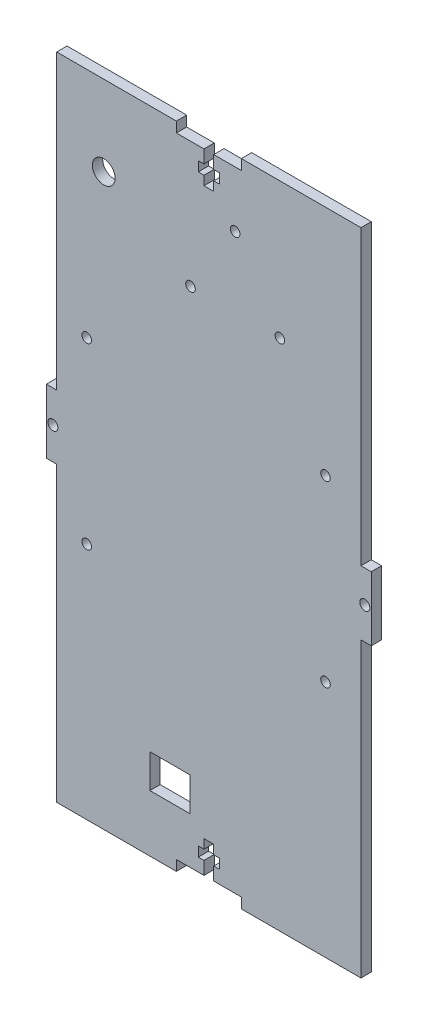
from build123d import *

# Parameters (mm, degrees)
SKETCH1_W           = 100
SKETCH1_H           = 200
BOSS_EXTRUDE2_DEPTH = 3.18
SKETCH2_R           = 1.55
SKETCH2_W           = 3.18
SKETCH2_H           = 90.125
CUT_EXTRUDE1_DEPTH  = 112.84861376
SKETCH4_W           = 12.353553391
SKETCH4_H           = 10.353553391
CUT_EXTRUDE3_DEPTH  = 112.84861376
SKETCH5_R           = 1.47
CUT_EXTRUDE4_DEPTH  = 112.84861376
SKETCH6_R           = 1.47
CUT_EXTRUDE5_DEPTH  = 112.84861376
SKETCH7_R           = 3.5
CUT_EXTRUDE6_DEPTH  = 113.563018017


with BuildPart() as part:
    # Sketch1 → Boss-Extrude2 (new body)
    with BuildSketch(Plane.XY):
        Rectangle(SKETCH1_W, SKETCH1_H)
    extrude(amount=BOSS_EXTRUDE2_DEPTH)

    # Sketch2 → Cut-Extrude1 (cut, through all)
    with BuildSketch(Plane.XY.offset(3.18)):
        with Locations((-48, 0)):
            Circle(SKETCH2_R)
        Polygon((-10, 100), (-10, 96.82), (-1.5, 96.82), (-1.5, 92.82), (-3.25, 92.82), (-3.25, 89.82), (-1.5, 89.82), (-1.5, 87), (1.5, 87), (1.5, 89.82), (3.25, 89.82), (3.25, 92.82), (1.5, 92.82), (1.5, 96.82), (10, 96.82), (10, 100), align=None)
        with Locations((-48.41, 54.9375)):
            Rectangle(SKETCH2_W, SKETCH2_H)
        with Locations((-48.41, -54.9375)):
            Rectangle(SKETCH2_W, SKETCH2_H)
    cut_extrude1 = extrude(amount=-CUT_EXTRUDE1_DEPTH, mode=Mode.SUBTRACT)

    # Mirror1: Cut-Extrude1 across plane
    add(cut_extrude1.mirror(Plane.ZX), mode=Mode.SUBTRACT)

    # Mirror3: Cut-Extrude1 across plane
    add(cut_extrude1.mirror(Plane(origin=(0, 0, 0), x_dir=(0, 0, 1), z_dir=(1, 0, 0))), mode=Mode.SUBTRACT)

    # Sketch4 → Cut-Extrude3 (cut, through all)
    with BuildSketch(Plane.XY.offset(3.18)):
        with Locations((-11.973223305, -77.343223305)):
            Rectangle(SKETCH4_W, SKETCH4_H)
    extrude(amount=-CUT_EXTRUDE3_DEPTH, mode=Mode.SUBTRACT)

    # Sketch5 → Cut-Extrude4 (cut, through all)
    with BuildSketch(Plane.XY.offset(3.18)):
        with Locations((-37.58090562, 28.464149283)):
            Circle(SKETCH5_R)
        with Locations((35.904481485, 28.464149283)):
            Circle(SKETCH5_R)
        with Locations((-37.58090562, -26.535850717)):
            Circle(SKETCH5_R)
        with Locations((35.904481485, -26.535850717)):
            Circle(SKETCH5_R)
    extrude(amount=-CUT_EXTRUDE4_DEPTH, mode=Mode.SUBTRACT)

    # Sketch6 → Cut-Extrude5 (cut, through all)
    with BuildSketch(Plane.XY.offset(3.18)):
        with Locations((-5.638260743, 58.12)):
            Circle(SKETCH6_R)
        with Locations((8.111739257, 79.62)):
            Circle(SKETCH6_R)
        with Locations((21.861739257, 58.12)):
            Circle(SKETCH6_R)
    extrude(amount=-CUT_EXTRUDE5_DEPTH, mode=Mode.SUBTRACT)

    # Sketch7 → Cut-Extrude6 (cut, through all)
    with BuildSketch(Plane.XY.offset(13.055)):
        with Locations((-32.354349711, 75.303329325)):
            Circle(SKETCH7_R)
    extrude(amount=-CUT_EXTRUDE6_DEPTH, mode=Mode.SUBTRACT)


solid = part.part
